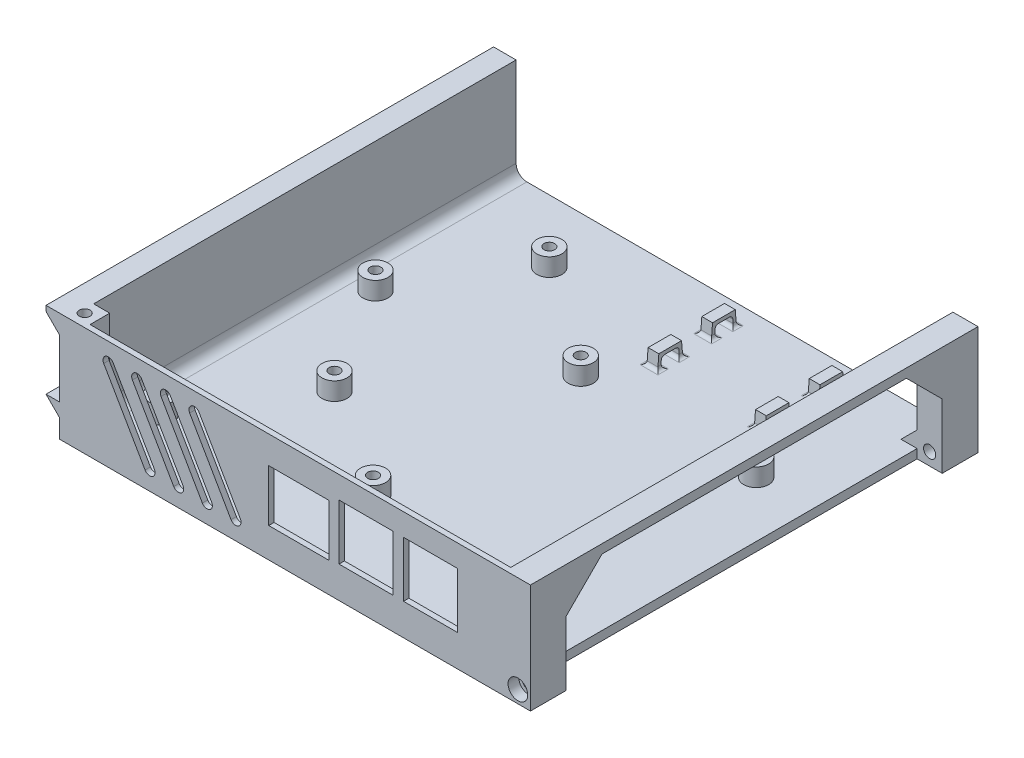
from build123d import *

# Parameters (mm, degrees)
SKETCH2_W                    = 124.5
SKETCH2_H                    = 125
BASE_PLATE_DEPTH             = 2.5
SKETCH3_R                    = 3.5
SKETCH3_R_2                  = 1.5
MOUNTING_HOLES_DEPTH         = 5
SKETCH5_W                    = 124.5
SKETCH5_H                    = 1.5
OUTSIDE_WALL_DEPTH           = 28
F_4040_EXTRUSION_MOUNT_DEPTH = 125
SKETCH7_W                    = 16.88
SKETCH7_H                    = 14.5
SKETCH7_W_2                  = 15.1
SKETCH7_H_2                  = 15.49
CUT_EXTRUDE1_DEPTH           = 1.5
FILLET1_R                    = 3
SKETCH14_R                   = 1.7
SKETCH14_W                   = 7
SKETCH14_H                   = 23.5
BOSS_EXTRUDE10_DEPTH         = 10
BOSS_EXTRUDE11_START         = -10
SKETCH15_W                   = 7
SKETCH15_H                   = 23.5
SKETCH15_R                   = 1.7
BOSS_EXTRUDE11_DEPTH         = 10
FILLET2_R                    = 1
SKETCH16_W                   = 7
SKETCH16_H                   = 2.5
BOSS_EXTRUDE12_DEPTH         = 105
RIB15_START                  = -7
RIB15_DEPTH                  = 7
RIB16_START                  = -7
RIB16_DEPTH                  = 7
BOSS_EXTRUDE13_REACH         = 183.703
SKETCH21_R                   = 1.5
CUT_EXTRUDE3_DEPTH           = 10
SKETCH22_R                   = 2.75
CUT_EXTRUDE4_DEPTH           = 3
CUT_EXTRUDE5_START           = -3
SKETCH23_R                   = 2.75
CUT_EXTRUDE5_DEPTH           = 3
BOSS_EXTRUDE14_START         = -25
BOSS_EXTRUDE14_DEPTH         = 3
LPATTERN2_COUNT              = 2
LPATTERN2_PITCH              = 30
LPATTERN2_COUNT_DIR2         = 2
LPATTERN2_PITCH_DIR2         = 15
FILLET3_R                    = 1
CUT_EXTRUDE6_DEPTH           = 1.5
LPATTERN3_COUNT              = 4
LPATTERN3_PITCH              = 8


# Read off the part's stored shape, not the designer's step: Rib15, Rib16
with BuildPart() as part:
    # Sketch2 → base-plate (new body)
    with BuildSketch(Plane(origin=(0, 0, 0), x_dir=(1, 0, 0), z_dir=(0, 1, 0))):
        with Locations((-62.25, 62.5)):
            Rectangle(SKETCH2_W, SKETCH2_H)
    extrude(amount=BASE_PLATE_DEPTH)

    # Sketch3 → mounting-holes (add)
    # profile 1 of 8: a face of its own
    with BuildSketch(Plane(origin=(0, 2.5, 0), x_dir=(1, 0, 0), z_dir=(0, 1, 0))):
        with Locations(Location((-113.79, 77.51, 0), (0, 0, 270))):
            Circle(SKETCH3_R)
        with Locations(Location((-113.79, 77.51, 0), (0, 0, 270))):
            Circle(SKETCH3_R_2, mode=Mode.SUBTRACT)
    # profile 2 of 8: a face of its own
    with BuildSketch(Plane(origin=(0, 2.5, 0), x_dir=(1, 0, 0), z_dir=(0, 1, 0))):
        with Locations(Location((-95.21, 107.49, 0), (0, 0, 270))):
            Circle(SKETCH3_R)
        with Locations(Location((-95.21, 107.49, 0), (0, 0, 270))):
            Circle(SKETCH3_R_2, mode=Mode.SUBTRACT)
    # profile 3 of 8: a face of its own
    with BuildSketch(Plane(origin=(0, 2.5, 0), x_dir=(1, 0, 0), z_dir=(0, 1, 0))):
        with Locations(Location((-95.21, 47.49, 0), (0, 0, 270))):
            Circle(SKETCH3_R)
        with Locations(Location((-95.21, 47.49, 0), (0, 0, 270))):
            Circle(SKETCH3_R_2, mode=Mode.SUBTRACT)
    # profile 4 of 8: a face of its own
    with BuildSketch(Plane(origin=(0, 2.5, 0), x_dir=(1, 0, 0), z_dir=(0, 1, 0))):
        with Locations(Location((-113.79, 17.51, 0), (0, 0, 270))):
            Circle(SKETCH3_R)
        with Locations(Location((-113.79, 17.51, 0), (0, 0, 270))):
            Circle(SKETCH3_R_2, mode=Mode.SUBTRACT)
    # profile 5 of 8: a face of its own
    with BuildSketch(Plane(origin=(0, 2.5, 0), x_dir=(1, 0, 0), z_dir=(0, 1, 0))):
        with Locations(Location((-64.5, 27.55, 0), (0, 0, 270))):
            Circle(SKETCH3_R)
        with Locations(Location((-64.5, 27.55, 0), (0, 0, 270))):
            Circle(SKETCH3_R_2, mode=Mode.SUBTRACT)
    # profile 6 of 8: a face of its own
    with BuildSketch(Plane(origin=(0, 2.5, 0), x_dir=(1, 0, 0), z_dir=(0, 1, 0))):
        with Locations(Location((-64.5, 85.55, 0), (0, 0, 270))):
            Circle(SKETCH3_R)
        with Locations(Location((-64.5, 85.55, 0), (0, 0, 270))):
            Circle(SKETCH3_R_2, mode=Mode.SUBTRACT)
    # profile 7 of 8: a face of its own
    with BuildSketch(Plane(origin=(0, 2.5, 0), x_dir=(1, 0, 0), z_dir=(0, 1, 0))):
        with Locations(Location((-15.5, 85.55, 0), (0, 0, 270))):
            Circle(SKETCH3_R)
        with Locations(Location((-15.5, 85.55, 0), (0, 0, 270))):
            Circle(SKETCH3_R_2, mode=Mode.SUBTRACT)
    # profile 8 of 8: a face of its own
    with BuildSketch(Plane(origin=(0, 2.5, 0), x_dir=(1, 0, 0), z_dir=(0, 1, 0))):
        with Locations(Location((-15.5, 27.55, 0), (0, 0, 270))):
            Circle(SKETCH3_R)
        with Locations(Location((-15.5, 27.55, 0), (0, 0, 270))):
            Circle(SKETCH3_R_2, mode=Mode.SUBTRACT)
    extrude(amount=MOUNTING_HOLES_DEPTH)

    # Sketch5 → outside-wall (add)
    with BuildSketch(Plane(origin=(0, 2.5, 0), x_dir=(1, 0, 0), z_dir=(0, 1, 0))):
        with Locations((-62.25, 0.75)):
            Rectangle(SKETCH5_W, SKETCH5_H)
    extrude(amount=OUTSIDE_WALL_DEPTH)

    # Sketch6 → 4040-extrusion-mount (add)
    with BuildSketch(Plane.XY):
        Polygon((-124.5, 5.2), (-124.5, 0), (-122, 0), (-122, 9), (-124.5, 9), align=None)
        Polygon((-126.3, 7), (-124.5, 5.2), (-124.5, 9), (-128.3, 9), align=None)
        Polygon((-124.5, 25.2), (-124.5, 9), (-122, 9), (-122, 30.5), (-124.5, 30.5), align=None)
        Polygon((-126.3, 27), (-124.5, 25.2), (-124.5, 30.5), (-128.3, 30.5), (-128.3, 29), align=None)
    extrude(amount=-F_4040_EXTRUSION_MOUNT_DEPTH)

    # Sketch7 → Cut-Extrude1 (cut)
    with BuildSketch(Plane.XY):
        with Locations((-57.66, 15.58)):
            Rectangle(SKETCH7_W, SKETCH7_H)
        with Locations((-38.91, 16.575)):
            Rectangle(SKETCH7_W_2, SKETCH7_H_2)
        with Locations((-20.91, 16.575)):
            Rectangle(SKETCH7_W_2, SKETCH7_H_2)
    extrude(amount=-CUT_EXTRUDE1_DEPTH, mode=Mode.SUBTRACT)

    # Fillet1
    fillet1_edges = [part.edges().sort_by_distance(p)[0] for p in [
        (-122, 2.5, -63.25),
    ]]
    fillet(fillet1_edges, radius=FILLET1_R)

    # Sketch14 → Boss-Extrude10 (add)
    # profile 1 of 3: a face of its own
    with BuildSketch(Plane.XY):
        Polygon((7, 7), (0, 7), (0, 2.5), (0, 0), (7, 0), align=None)
        with Locations((3.5, 3.5)):
            Circle(SKETCH14_R, mode=Mode.SUBTRACT)
    # profile 2 of 3: a face of its own
    with BuildSketch(Plane.XY):
        with Locations((3.5, 18.75)):
            Rectangle(SKETCH14_W, SKETCH14_H)
    # profile 3 of 3: a face of its own
    with BuildSketch(Plane.XY):
        Polygon((0, 2.5), (0, 7), (-4.5, 2.5), align=None)
    extrude(amount=-BOSS_EXTRUDE10_DEPTH)

    # Sketch15 → Boss-Extrude11 (add)
    # profile 1 of 3: a face of its own
    with BuildSketch(Plane(origin=(0, 0, -125), x_dir=(-1, 0, 0), z_dir=(0, 0, -1)).offset(BOSS_EXTRUDE11_START)):
        with Locations((-3.5, 18.75)):
            Rectangle(SKETCH15_W, SKETCH15_H)
    # profile 2 of 3: a face of its own
    with BuildSketch(Plane(origin=(0, 0, -125), x_dir=(-1, 0, 0), z_dir=(0, 0, -1)).offset(BOSS_EXTRUDE11_START)):
        Polygon((0, 2.5), (0, 7), (-7, 7), (-7, 0), (0, 0), align=None)
        with Locations(Location((-3.5, 3.5, 0), (0, 0, 180))):
            Circle(SKETCH15_R, mode=Mode.SUBTRACT)
    # profile 3 of 3: a face of its own
    with BuildSketch(Plane(origin=(0, 0, -125), x_dir=(-1, 0, 0), z_dir=(0, 0, -1)).offset(BOSS_EXTRUDE11_START)):
        Polygon((4.5, 2.5), (0, 7), (0, 2.5), align=None)
    extrude(amount=BOSS_EXTRUDE11_DEPTH)

    # Fillet2
    fillet2_edges = [part.edges().sort_by_distance(p)[0] for p in [
        (-128.3, 29, -62.5),
    ]]
    fillet(fillet2_edges, radius=FILLET2_R)

    # Sketch16 → Boss-Extrude12 (add)
    with BuildSketch(Plane(origin=(0, 0, -10), x_dir=(-1, 0, 0), z_dir=(0, 0, -1))):
        with Locations((-3.5, 29.25)):
            Rectangle(SKETCH16_W, SKETCH16_H)
    extrude(amount=BOSS_EXTRUDE12_DEPTH)

    # Rib15 outline → Rib15 (add)
    with BuildSketch(Plane(origin=(7, 0, 0), x_dir=(0, 0, -1), z_dir=(1, 0, 0)).offset(RIB15_START)):
        Polygon((10, 28), (10, 18), (20, 28), align=None)
    extrude(amount=RIB15_DEPTH)

    # Rib16 outline → Rib16 (add)
    with BuildSketch(Plane(origin=(7, 0, 0), x_dir=(0, 0, -1), z_dir=(1, 0, 0)).offset(RIB16_START)):
        Polygon((105, 28), (115, 18), (115, 28), align=None)
    extrude(amount=RIB16_DEPTH)

    # Boss-Extrude13: up to this face of the body (flat: up to its plane)
    boss_extrude13_end = Plane(part.part.faces().sort_by_distance((-59.558764104, 2.5, -63.305396203))[0])
    # Sketch20 → Boss-Extrude13 (add, up to the picked face)
    with BuildSketch(Plane(origin=(0, 30.5, 0), x_dir=(1, 0, 0), z_dir=(0, 1, 0)), mode=Mode.PRIVATE) as boss_extrude13_sk1:
        with BuildLine():
            Line((-122, 2.381966011), (-122, 4.618033989))
            ThreePointArc((-122, 4.618033989), (-122.5, 3.5), (-122, 2.381966011))
        make_face()
    boss_extrude13_tool1 = split(extrude(boss_extrude13_sk1.sketch, amount=-BOSS_EXTRUDE13_REACH, mode=Mode.PRIVATE), bisect_by=boss_extrude13_end, keep=Keep.BOTH, mode=Mode.PRIVATE)
    # Sketch20 → Boss-Extrude13 (add, up to the picked face)
    with BuildSketch(Plane(origin=(0, 30.5, 0), x_dir=(1, 0, 0), z_dir=(0, 1, 0)), mode=Mode.PRIVATE) as boss_extrude13_sk2:
        with BuildLine():
            ThreePointArc((-119.5, 3.5), (-120.387627564, 4.869306394), (-122, 4.618033989))
            Line((-122, 4.618033989), (-122, 2.381966011))
            ThreePointArc((-122, 2.381966011), (-120.387627564, 2.130693606), (-119.5, 3.5))
        make_face()
    boss_extrude13_tool2 = split(extrude(boss_extrude13_sk2.sketch, amount=-BOSS_EXTRUDE13_REACH, mode=Mode.PRIVATE), bisect_by=boss_extrude13_end, keep=Keep.BOTH, mode=Mode.PRIVATE)
    # Sketch20 → Boss-Extrude13 (add, up to the picked face)
    with BuildSketch(Plane(origin=(0, 30.5, 0), x_dir=(1, 0, 0), z_dir=(0, 1, 0)), mode=Mode.PRIVATE) as boss_extrude13_sk3:
        with BuildLine():
            Line((-122, 1.5), (-117.5, 1.5))
            Line((-117.5, 1.5), (-117.5, 7))
            Line((-117.5, 7), (-122, 7))
            Line((-122, 7), (-122, 4.618033989))
            ThreePointArc((-122, 4.618033989), (-120.387627564, 4.869306394), (-119.5, 3.5))
            ThreePointArc((-119.5, 3.5), (-120.387627564, 2.130693606), (-122, 2.381966011))
            Line((-122, 2.381966011), (-122, 1.5))
        make_face()
    boss_extrude13_tool3 = split(extrude(boss_extrude13_sk3.sketch, amount=-BOSS_EXTRUDE13_REACH, mode=Mode.PRIVATE), bisect_by=boss_extrude13_end, keep=Keep.BOTH, mode=Mode.PRIVATE)
    # Sketch20 → Boss-Extrude13 (add, up to the picked face)
    with BuildSketch(Plane(origin=(0, 30.5, 0), x_dir=(1, 0, 0), z_dir=(0, 1, 0)), mode=Mode.PRIVATE) as boss_extrude13_sk4:
        with BuildLine():
            Line((-124.5, 7), (-124.5, 0))
            Line((-124.5, 0), (-117.5, 0))
            Line((-117.5, 0), (-117.5, 1.5))
            Line((-117.5, 1.5), (-122, 1.5))
            Line((-122, 1.5), (-122, 2.381966011))
            ThreePointArc((-122, 2.381966011), (-122.5, 3.5), (-122, 4.618033989))
            Line((-122, 4.618033989), (-122, 7))
            Line((-122, 7), (-124.5, 7))
        make_face()
    boss_extrude13_tool4 = split(extrude(boss_extrude13_sk4.sketch, amount=-BOSS_EXTRUDE13_REACH, mode=Mode.PRIVATE), bisect_by=boss_extrude13_end, keep=Keep.BOTH, mode=Mode.PRIVATE)
    # Sketch20 → Boss-Extrude13 (add, up to the picked face)
    with BuildSketch(Plane(origin=(0, 30.5, 0), x_dir=(1, 0, 0), z_dir=(0, 1, 0)), mode=Mode.PRIVATE) as boss_extrude13_sk5:
        with BuildLine():
            Line((-122, 2.381966011), (-122, 4.618033989))
            ThreePointArc((-122, 4.618033989), (-122.5, 3.5), (-122, 2.381966011))
        make_face()
    boss_extrude13_tool5 = split(extrude(boss_extrude13_sk5.sketch, amount=-BOSS_EXTRUDE13_REACH, mode=Mode.PRIVATE), bisect_by=boss_extrude13_end, keep=Keep.BOTH, mode=Mode.PRIVATE)
    # Sketch20 → Boss-Extrude13 (add, up to the picked face)
    with BuildSketch(Plane(origin=(0, 30.5, 0), x_dir=(1, 0, 0), z_dir=(0, 1, 0)), mode=Mode.PRIVATE) as boss_extrude13_sk6:
        with BuildLine():
            ThreePointArc((-119.5, 3.5), (-120.387627564, 4.869306394), (-122, 4.618033989))
            Line((-122, 4.618033989), (-122, 2.381966011))
            ThreePointArc((-122, 2.381966011), (-120.387627564, 2.130693606), (-119.5, 3.5))
        make_face()
    boss_extrude13_tool6 = split(extrude(boss_extrude13_sk6.sketch, amount=-BOSS_EXTRUDE13_REACH, mode=Mode.PRIVATE), bisect_by=boss_extrude13_end, keep=Keep.BOTH, mode=Mode.PRIVATE)
    add(boss_extrude13_tool1.solids().sort_by(Axis((-122.203164, 30.5, -3.5), (0, -1, 0)))[0])
    add(boss_extrude13_tool2.solids().sort_by(Axis((-120.851976, 30.5, -3.5), (0, -1, 0)))[0])
    add(boss_extrude13_tool3.solids().sort_by(Axis((-119.374179, 30.5, -4.505782), (0, -1, 0)))[0])
    add(boss_extrude13_tool4.solids().sort_by(Axis((-122.278168, 30.5, -2.709286), (0, -1, 0)))[0])
    add(boss_extrude13_tool5.solids().sort_by(Axis((-122.203164, 30.5, -3.5), (0, -1, 0)))[0])
    add(boss_extrude13_tool6.solids().sort_by(Axis((-120.851976, 30.5, -3.5), (0, -1, 0)))[0])

    # Sketch21 → Cut-Extrude3 (cut)
    with BuildSketch(Plane(origin=(0, 30.5, 0), x_dir=(1, 0, 0), z_dir=(0, 1, 0))):
        with Locations(Location((-121, 3.5, 0), (0, 0, 270))):
            Circle(SKETCH21_R)
    extrude(amount=-CUT_EXTRUDE3_DEPTH, mode=Mode.SUBTRACT)

    # Sketch22 → Cut-Extrude4 (cut)
    with BuildSketch(Plane.XY):
        with Locations((3.5, 3.5)):
            Circle(SKETCH22_R)
    extrude(amount=-CUT_EXTRUDE4_DEPTH, mode=Mode.SUBTRACT)

    # Sketch23 → Cut-Extrude5 (cut)
    with BuildSketch(Plane(origin=(0, 0, -125), x_dir=(-1, 0, 0), z_dir=(0, 0, -1)).offset(CUT_EXTRUDE5_START)):
        with Locations(Location((-3.5, 3.5, 0), (0, 0, 180))):
            Circle(SKETCH23_R)
    extrude(amount=CUT_EXTRUDE5_DEPTH, mode=Mode.SUBTRACT)

    # Sketch25 → Boss-Extrude14 (add)
    with BuildSketch(Plane(origin=(0, 0, 0), x_dir=(0, 0, -1), z_dir=(1, 0, 0)).offset(BOSS_EXTRUDE14_START)):
        with BuildLine():
            Line((98.533333333, 2.5), (98.533333333, 4.5))
            ThreePointArc((98.533333333, 4.5), (98.826226552, 5.207106781), (99.533333333, 5.5))
            Line((99.533333333, 5.5), (102.533333333, 5.5))
            ThreePointArc((102.533333333, 5.5), (103.240440115, 5.207106781), (103.533333333, 4.5))
            Line((103.533333333, 4.5), (103.533333333, 2.5))
            Line((103.533333333, 2.5), (104.533333333, 2.5))
            Line((104.533333333, 2.5), (104.203396065, 6.5))
            Line((104.203396065, 6.5), (97.863270602, 6.5))
            Line((97.863270602, 6.5), (97.533333333, 2.5))
            Line((97.533333333, 2.5), (98.533333333, 2.5))
        make_face()
    boss_extrude14 = extrude(amount=-BOSS_EXTRUDE14_DEPTH)

    # LPattern2: Boss-Extrude14 2 × 2
    with Locations(*[(-i * LPATTERN2_PITCH, 0, -j * LPATTERN2_PITCH_DIR2) for i in range(LPATTERN2_COUNT) for j in range(LPATTERN2_COUNT_DIR2) if (i, j) != (0, 0)]):
        add(boss_extrude14)

    # Fillet3
    fillet3_edges = [part.edges().sort_by_distance(p)[0] for p in [
        (-28, 2.5, -98.033333333),
        (-26.5, 2.5, -98.533333333),
        (-26.5, 2.5, -97.533333333),
        (-28, 2.5, -104.033333333),
        (-26.5, 2.5, -104.533333333),
        (-26.5, 2.5, -103.533333333),
        (-25, 2.5, -98.033333333),
        (-25, 2.5, -104.033333333),
        (-28, 2.5, -113.033333333),
        (-26.5, 2.5, -113.533333333),
        (-26.5, 2.5, -112.533333333),
        (-28, 2.5, -119.033333333),
        (-26.5, 2.5, -119.533333333),
        (-26.5, 2.5, -118.533333333),
        (-25, 2.5, -113.033333333),
        (-25, 2.5, -119.033333333),
        (-58, 2.5, -98.033333333),
        (-56.5, 2.5, -98.533333333),
        (-56.5, 2.5, -97.533333333),
        (-58, 2.5, -104.033333333),
        (-56.5, 2.5, -104.533333333),
        (-56.5, 2.5, -103.533333333),
        (-55, 2.5, -98.033333333),
        (-55, 2.5, -104.033333333),
        (-58, 2.5, -113.033333333),
        (-56.5, 2.5, -113.533333333),
        (-56.5, 2.5, -112.533333333),
        (-58, 2.5, -119.033333333),
        (-56.5, 2.5, -119.533333333),
        (-56.5, 2.5, -118.533333333),
        (-55, 2.5, -113.033333333),
        (-55, 2.5, -119.033333333),
    ]]
    fillet(fillet3_edges, radius=FILLET3_R)

    # Sketch26 → Cut-Extrude6 (cut)
    with BuildSketch(Plane.XY):
        with BuildLine():
            Line((-85.574464586, 26), (-74.027459202, 6))
            ThreePointArc((-74.027459202, 6), (-74.576497308, 3.950961894), (-76.625535414, 4.5))
            Line((-76.625535414, 4.5), (-88.172540798, 24.5))
            ThreePointArc((-88.172540798, 24.5), (-87.623502692, 26.549038106), (-85.574464586, 26))
        make_face()
    cut_extrude6 = extrude(amount=-CUT_EXTRUDE6_DEPTH, mode=Mode.SUBTRACT)

    # LPattern3: Cut-Extrude6 ×4
    with Locations(*[(-i * LPATTERN3_PITCH, 0, 0) for i in range(1, LPATTERN3_COUNT)]):
        add(cut_extrude6, mode=Mode.SUBTRACT)


solid = part.part
